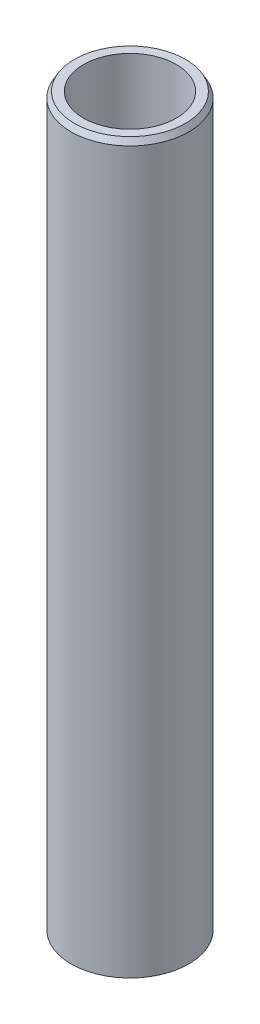
from build123d import *
from OCP.BRepFilletAPI import BRepFilletAPI_MakeChamfer

# Parameters (mm, degrees)
SKETCH1_R           = 32.5
BOSS_EXTRUDE1_DEPTH = 403.0289379
SKETCH2_R           = 25.666674585
CUT_EXTRUDE1_DEPTH  = 406.641251335
CHAMFER1_SIZE       = 3.175661899
CHAMFER1_SIZE2      = 1.833469252


with BuildPart() as part:
    # Sketch1 → Boss-Extrude1 (new body)
    with BuildSketch(Plane(origin=(0, 0, 0), x_dir=(1, 0, 0), z_dir=(0, 1, 0))):
        Circle(SKETCH1_R)
    extrude(amount=BOSS_EXTRUDE1_DEPTH)

    # Sketch2 → Cut-Extrude1 (cut, through all)
    with BuildSketch(Plane(origin=(0, 0, 0), x_dir=(1, 0, 0), z_dir=(0, 1, 0))):
        Circle(SKETCH2_R)
    extrude(amount=CUT_EXTRUDE1_DEPTH, mode=Mode.SUBTRACT)

    # Chamfer1: one chamfer whose edges measure the first distance from different faces: ONE call of the kernel's chamfer builder (chamfer() names one face for all edges)
    chamfer1_edges_1 = [part.edges().sort_by_distance(p)[0] for p in [
        (-32.5, 403.0289379, 0),
    ]]
    chamfer1_side_1 = [part.faces().sort_by_distance(p)[0] for p in [
        (-32.5, 201.51446895, 0),
    ]]
    chamfer1_edges_2 = [part.edges().sort_by_distance(p)[0] for p in [
        (-32.5, 0, 0),
    ]]
    chamfer1_side_2 = [part.faces().sort_by_distance(p)[0] for p in [
        (-31.580761184, 0, 0),
    ]]
    chamfer1 = BRepFilletAPI_MakeChamfer(part.part.solid().wrapped)
    for e in chamfer1_edges_1:
        chamfer1.Add(CHAMFER1_SIZE, CHAMFER1_SIZE2, e.wrapped, chamfer1_side_1[0].wrapped)  # the first distance lies on this face
    for e in chamfer1_edges_2:
        chamfer1.Add(CHAMFER1_SIZE, CHAMFER1_SIZE2, e.wrapped, chamfer1_side_2[0].wrapped)  # the first distance lies on this face
    add(Compound.cast(chamfer1.Shape()), mode=Mode.REPLACE)


solid = part.part
